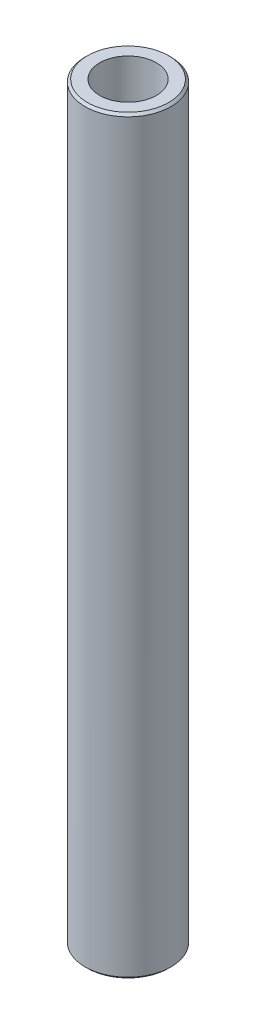
from build123d import *

# Parameters (mm, degrees)
SKETCH1_R           = 27.5
BOSS_EXTRUDE1_DEPTH = 480.079677368
SKETCH2_R           = 18.16181233
CUT_EXTRUDE1_DEPTH  = 482.652360756
CHAMFER1_SIZE       = 1.510065892


with BuildPart() as part:
    # Sketch1 → Boss-Extrude1 (new body)
    with BuildSketch(Plane(origin=(0, 0, 0), x_dir=(1, 0, 0), z_dir=(0, 1, 0))):
        Circle(SKETCH1_R)
    extrude(amount=BOSS_EXTRUDE1_DEPTH)

    # Sketch2 → Cut-Extrude1 (cut, through all)
    with BuildSketch(Plane(origin=(0, 0, 0), x_dir=(1, 0, 0), z_dir=(0, 1, 0))):
        Circle(SKETCH2_R)
    extrude(amount=CUT_EXTRUDE1_DEPTH, mode=Mode.SUBTRACT)

    # Chamfer1
    chamfer1_edges = [part.edges().sort_by_distance(p)[0] for p in [
        (-27.5, 480.079677368, 0),
        (-27.5, 0, 0),
    ]]
    chamfer(chamfer1_edges, length=CHAMFER1_SIZE)


solid = part.part
